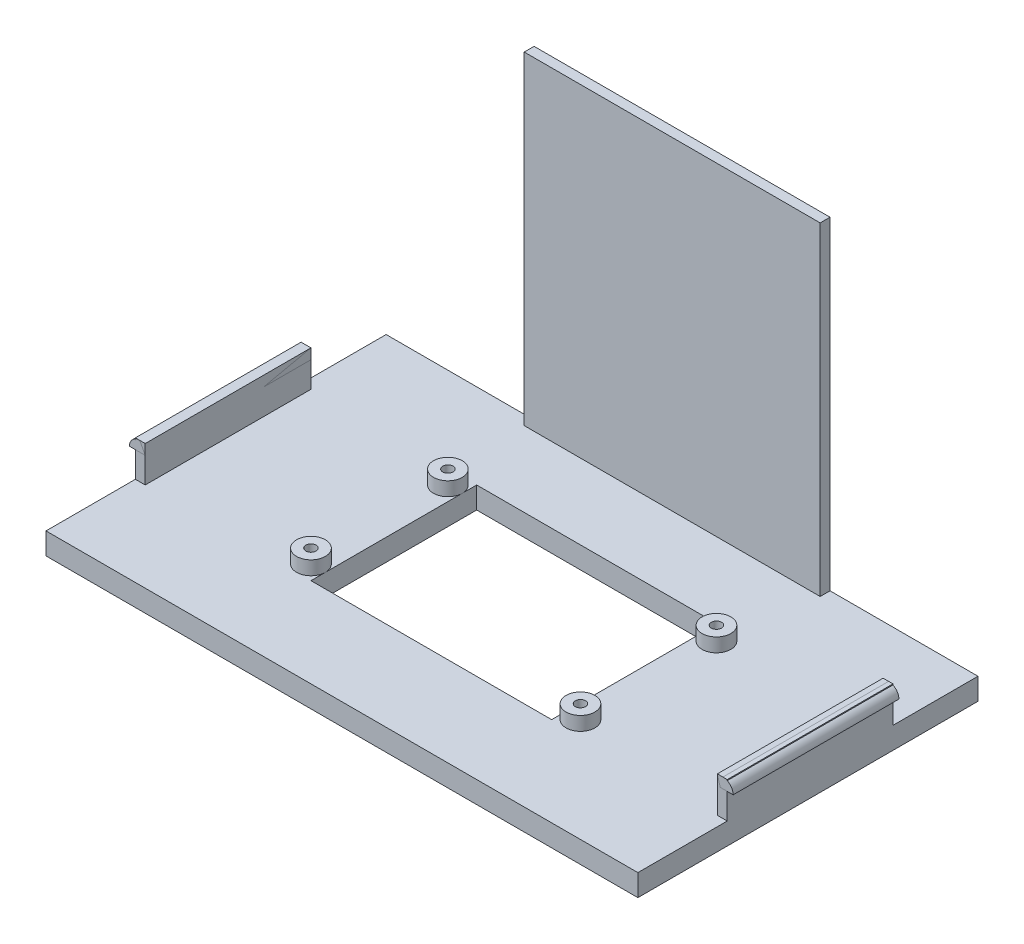
from build123d import *

# Parameters (mm, degrees)
ESBO_O1_W                  = 150
ESBO_O1_H                  = 86.2
ESBO_O1_W_2                = 61
ESBO_O1_H_2                = 42
RESSALTO_EXTRUS_O1_DEPTH   = 5.5
ESBO_O2_W                  = 2.5
ESBO_O2_H                  = 42
RESSALTO_EXTRUS_O2_DEPTH   = 14.6
RESSALTO_EXTRUS_O3_DEPTH   = 2.6
RESSALTO_EXTRUS_O3_2_DEPTH = 2.6
FILETE3_R                  = 2.6
FILETE4_R                  = 2.6
F_3DSKETCH3_R              = 3.65
F_3DSKETCH3_R_2            = 1.3
RESSALTO_EXTRUS_O4_DEPTH   = 3.5
RESSALTO_EXTRUS_O5_DEPTH   = 82


with BuildPart() as part:
    # Esboço1 → Ressalto-extrusão1 (new body)
    with BuildSketch(Plane(origin=(0, 0, 0), x_dir=(1, 0, 0), z_dir=(0, 1, 0))):
        with Locations((75, 43.1)):
            Rectangle(ESBO_O1_W, ESBO_O1_H)
        with Locations((75, 43.65)):
            Rectangle(ESBO_O1_W_2, ESBO_O1_H_2, mode=Mode.SUBTRACT)
    extrude(amount=RESSALTO_EXTRUS_O1_DEPTH)

    # Esboço2 → Ressalto-extrusão2 (add)
    with BuildSketch(Plane(origin=(0, 0, 0), x_dir=(1, 0, 0), z_dir=(0, 1, 0))):
        with Locations((1.25, 43.65)):
            Rectangle(ESBO_O2_W, ESBO_O2_H)
        with Locations((148.75, 43.65)):
            Rectangle(ESBO_O2_W, ESBO_O2_H)
    extrude(amount=RESSALTO_EXTRUS_O2_DEPTH)

    # 3DSketch3 → Ressalto-extrusão4 (add)
    # profile 1 of 4: a face of its own
    with BuildSketch(Plane(origin=(109.15, 5.5, -26.3), x_dir=(-0.8915370353260333, 0, -0.45294780564880466), z_dir=(0, 1, 0))):
        with Locations(Location((0, 0, 0), (0, 0, 26.932969981))):
            Circle(F_3DSKETCH3_R)
        with Locations(Location((0, 0, 0), (0, 0, 296.932969981))):
            Circle(F_3DSKETCH3_R_2, mode=Mode.SUBTRACT)
    # profile 2 of 4: a face of its own
    with BuildSketch(Plane(origin=(109.15, 5.5, -26.3), x_dir=(-0.8915370353260333, 0, -0.45294780564880466), z_dir=(0, 1, 0))):
        with Locations(Location((15.610778124, -30.726690082, 0), (0, 0, 26.932969981))):
            Circle(F_3DSKETCH3_R)
        with Locations(Location((15.610778124, -30.726690082, 0), (0, 0, 116.932969981))):
            Circle(F_3DSKETCH3_R_2, mode=Mode.SUBTRACT)
    # profile 3 of 4: a face of its own
    with BuildSketch(Plane(origin=(109.15, 5.5, -26.3), x_dir=(-0.8915370353260333, 0, -0.45294780564880466), z_dir=(0, 1, 0))):
        with Locations(Location((60.891979513, 30.936335126, 0), (0, 0, 206.932969981))):
            Circle(F_3DSKETCH3_R)
        with Locations(Location((60.891979513, 30.936335126, 0), (0, 0, 296.932969981))):
            Circle(F_3DSKETCH3_R_2, mode=Mode.SUBTRACT)
    # profile 4 of 4: a face of its own
    with BuildSketch(Plane(origin=(109.15, 5.5, -26.3), x_dir=(-0.8915370353260333, 0, -0.45294780564880466), z_dir=(0, 1, 0))):
        with Locations(Location((76.609268369, 0, 0), (0, 0, 206.932969981))):
            Circle(F_3DSKETCH3_R)
        with Locations(Location((76.609268369, 0, 0), (0, 0, 116.932969981))):
            Circle(F_3DSKETCH3_R_2, mode=Mode.SUBTRACT)
    extrude(amount=RESSALTO_EXTRUS_O4_DEPTH)

    # 3DSketch4 → Ressalto-extrusão5 (add)
    with BuildSketch(Plane(origin=(112.5, 5.5, -86.2), x_dir=(-0.9994449069791543, 0, 0.03331483023263851), z_dir=(0, -1, 0))):
        Polygon((0, 0), (74.958368023, 2.498612267), (75.041655099, 0), (0.083287076, -2.498612267), align=None)
    extrude(amount=-RESSALTO_EXTRUS_O5_DEPTH)


with BuildPart() as body_2:
    # 3DSketch2 → Ressalto-extrusão3 (new body)
    with BuildSketch(Plane(origin=(147.5, 14.6, -22.65), x_dir=(-0.962492938133368, 0, -0.27130673423893603), z_dir=(0, -1, 0))):
        Polygon((0, 0), (-3.849971753, 1.085226937), (7.544911086, 41.509930339), (11.394882838, 40.424703402), align=None)
    extrude(amount=RESSALTO_EXTRUS_O3_DEPTH)

    # Filete4
    filete4_edges = [body_2.edges().sort_by_distance(p)[0] for p in [
        (151.5, 14.6, -43.65),
    ]]
    fillet(filete4_edges, radius=FILETE4_R - 0.0001)  # a hair under: the kernel refuses the full size


with BuildPart() as body_3:
    # 3DSketch2 → Ressalto-extrus_o3 2 (new body)
    with BuildSketch(Plane(origin=(147.5, 14.6, -22.65), x_dir=(-0.962492938133368, 0, -0.27130673423893603), z_dir=(0, -1, 0))):
        Polygon((139.561476029, -39.339476465), (143.411447782, -40.424703402), (154.80633062, 0), (150.956358867, 1.085226937), align=None)
    extrude(amount=RESSALTO_EXTRUS_O3_2_DEPTH)

    # Filete3
    filete3_edges = [body_3.edges().sort_by_distance(p)[0] for p in [
        (-1.5, 14.6, -43.65),
    ]]
    fillet(filete3_edges, radius=FILETE3_R - 0.0001)  # a hair under: the kernel refuses the full size


solid = Compound([part.part, body_2.part, body_3.part])
